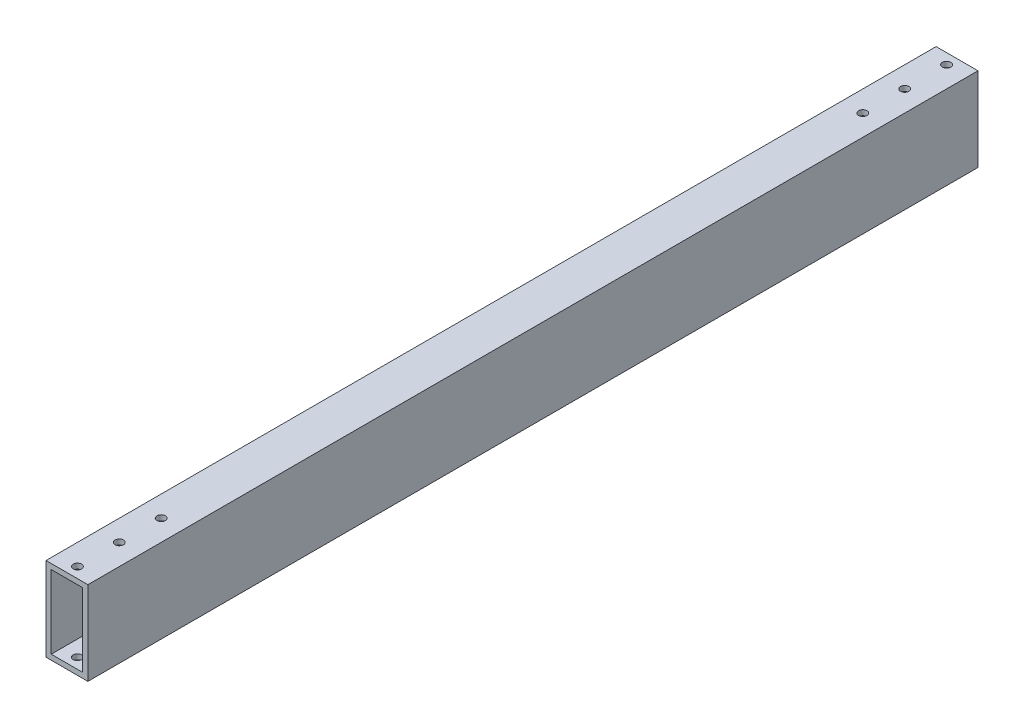
from build123d import *

# Parameters (mm, degrees)
SKETCH1_W              = 25.4
SKETCH1_H              = 50.8
SKETCH1_W_2            = 19.05
SKETCH1_H_2            = 44.45
EXTRUDE_THIN1_DEPTH    = 539.75
F_10_CLEARANCE_HOLE2_D = 5.1054


with BuildPart() as part:
    # Sketch1 → Extrude-Thin1 (new body)
    with BuildSketch(Plane.XY):
        Rectangle(SKETCH1_W, SKETCH1_H)
        Rectangle(SKETCH1_W_2, SKETCH1_H_2, mode=Mode.SUBTRACT)
    extrude(amount=EXTRUDE_THIN1_DEPTH)

    # #10 Clearance Hole2 (through all)
    with Locations(Plane(origin=(0, 25.4, 0), x_dir=(1, 0, 0), z_dir=(0, 1, 0))):
        with Locations((0, -533.4), (0, -508), (0, -482.6), (0, -6.35), (0, -31.75), (0, -57.15)):
            Hole(F_10_CLEARANCE_HOLE2_D / 2)


solid = part.part
